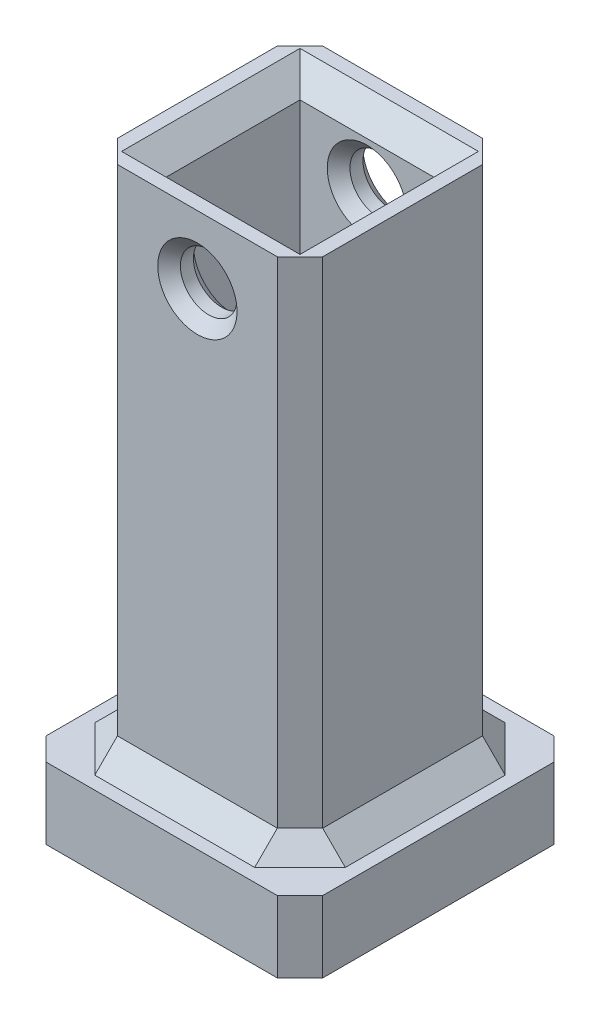
from build123d import *

# Parameters (mm, degrees)
SKETCH1_W           = 23
SKETCH1_H           = 23
SKETCH1_W_2         = 15
SKETCH1_H_2         = 15
BOSS_EXTRUDE1_DEPTH = 66
CHAMFER1_SIZE       = 2.5
SKETCH3_W           = 31
SKETCH3_H           = 31
SKETCH3_W_2         = 23
SKETCH3_H_2         = 23
BOSS_EXTRUDE2_DEPTH = 8
SKETCH4_R           = 3.175
CUT_EXTRUDE1_DEPTH  = 73.974310548
CHAMFER2_SIZE       = 1.27
CHAMFER3_SIZE       = 2.54


with BuildPart() as part:
    # Sketch1 → Boss-Extrude1 (new body)
    with BuildSketch(Plane(origin=(0, 0, 0), x_dir=(1, 0, 0), z_dir=(0, 1, 0))):
        Rectangle(SKETCH1_W, SKETCH1_H)
        Rectangle(SKETCH1_W_2, SKETCH1_H_2, mode=Mode.SUBTRACT)
    extrude(amount=BOSS_EXTRUDE1_DEPTH)

    # Chamfer1
    chamfer1_edges = [part.edges().sort_by_distance(p)[0] for p in [
        (0, 66, -7.5),
        (-7.5, 66, 0),
        (0, 66, 7.5),
        (7.5, 66, 0),
    ]]
    chamfer(chamfer1_edges, length=CHAMFER1_SIZE)

    # Sketch3 → Boss-Extrude2 (add)
    with BuildSketch(Plane.XZ):
        Rectangle(SKETCH3_W, SKETCH3_H)
        Rectangle(SKETCH3_W_2, SKETCH3_H_2, mode=Mode.SUBTRACT)
    extrude(amount=-BOSS_EXTRUDE2_DEPTH)

    # Sketch4 → Cut-Extrude1 (cut, through all)
    with BuildSketch(Plane.XY.offset(11.5)):
        with Locations((0, 58.42)):
            Circle(SKETCH4_R)
    extrude(amount=-CUT_EXTRUDE1_DEPTH, mode=Mode.SUBTRACT)

    # Chamfer2
    chamfer2_edges = [part.edges().sort_by_distance(p)[0] for p in [
        (-3.175, 58.42, -11.5),
        (-3.175, 58.42, -7.5),
        (-3.175, 58.42, 7.5),
        (-3.175, 58.42, 11.5),
    ]]
    chamfer(chamfer2_edges, length=CHAMFER2_SIZE)

    # Chamfer3
    chamfer3_edges = [part.edges().sort_by_distance(p)[0] for p in [
        (-11.5, 37, -11.5),
        (11.5, 37, -11.5),
        (11.5, 37, 11.5),
        (-11.5, 37, 11.5),
        (-11.5, 8, 0),
        (0, 8, 11.5),
        (11.5, 8, 0),
        (0, 8, -11.5),
        (-15.5, 4, -15.5),
        (15.5, 4, -15.5),
        (15.5, 4, 15.5),
        (-15.5, 4, 15.5),
    ]]
    chamfer(chamfer3_edges, length=CHAMFER3_SIZE)


solid = part.part
